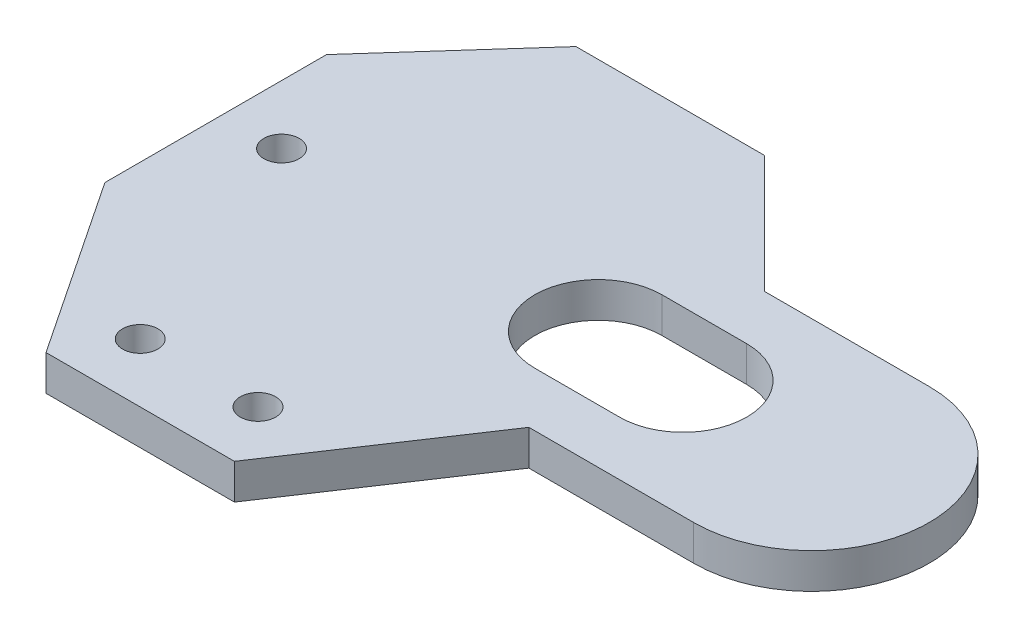
from build123d import *

# Parameters (mm, degrees)
SKETCH1_R           = 1.5
BOSS_EXTRUDE1_DEPTH = 3
FILLET5_RADIUS      = 10
FILLET5_LENGTH      = 3
FILLET2_R           = 5.4
FILLET4_R           = 5.4


with BuildPart() as part:
    # Sketch1 → Boss-Extrude1 (new body)
    # profile 1 of 2: a face of its own
    with BuildSketch(Plane(origin=(0, 0, 0), x_dir=(1, 0, 0), z_dir=(0, 1, 0))):
        with BuildLine():
            Line((3.5, 25), (0, 25))
            Line((0, 25), (0, 15))
            Line((0, 15), (10, 0))
            Line((10, 0), (26, 0))
            Line((26, 0), (36, 15))
            Line((36, 15), (60, 15))
            Line((60, 15), (60, 25))
            Line((60, 25), (44.5, 25))
            Line((44.5, 25), (44.5, 19.6))
            Line((44.5, 19.6), (26.5, 19.6))
            Line((26.5, 19.6), (26.5, 25))
            Line((26.5, 25), (6.5, 25))
            ThreePointArc((6.5, 25), (5, 23.5), (3.5, 25))
        make_face()
        with Locations(Location((13, 5, 0), (0, 0, 270))):
            Circle(SKETCH1_R, mode=Mode.SUBTRACT)
        with Locations(Location((23, 5, 0), (0, 0, 270))):
            Circle(SKETCH1_R, mode=Mode.SUBTRACT)
    # profile 2 of 2: a face of its own
    with BuildSketch(Plane(origin=(0, 0, 0), x_dir=(1, 0, 0), z_dir=(0, 1, 0))):
        with BuildLine():
            Line((10, 45), (0, 33.819660113))
            Line((0, 33.819660113), (0, 25))
            Line((0, 25), (3.5, 25))
            ThreePointArc((3.5, 25), (5, 26.5), (6.5, 25))
            Line((6.5, 25), (26.5, 25))
            Line((26.5, 25), (26.5, 30.4))
            Line((26.5, 30.4), (44.5, 30.4))
            Line((44.5, 30.4), (44.5, 25))
            Line((44.5, 25), (60, 25))
            Line((60, 25), (60, 35))
            Line((60, 35), (36, 35))
            Line((36, 35), (26, 45))
            Line((26, 45), (10, 45))
        make_face()
    extrude(amount=BOSS_EXTRUDE1_DEPTH)

    # Fillet5: full round fillet: the end face becomes a half cylinder, R = half its width
    fillet5_face = Plane((60, 1.5, -25), x_dir=(0, -1, 0), z_dir=(1, 0, 0))  # on the end face: x along it, z out of the body
    fillet5_slab = fillet5_face.offset(-FILLET5_RADIUS / 2) * Box(FILLET5_LENGTH, 2 * FILLET5_RADIUS, FILLET5_RADIUS, mode=Mode.PRIVATE)  # the body's end, R deep
    fillet5_round = Plane((50, 1.5, -25), x_dir=(1, 0, 0), z_dir=(0, -1, 0)) * Cylinder(FILLET5_RADIUS, FILLET5_LENGTH, mode=Mode.PRIVATE)  # its axis R under the face
    add(fillet5_slab - fillet5_round, mode=Mode.SUBTRACT)

    # Fillet2
    fillet2_edges = [part.edges().sort_by_distance(p)[0] for p in [
        (26.5, 1.5, -30.4),
        (26.5, 1.5, -19.6),
    ]]
    fillet(fillet2_edges, radius=FILLET2_R - 0.0001)  # a hair under: the kernel refuses the full size

    # Fillet4
    fillet4_edges = [part.edges().sort_by_distance(p)[0] for p in [
        (44.5, 1.5, -19.6),
        (44.5, 1.5, -30.4),
    ]]
    fillet(fillet4_edges, radius=FILLET4_R - 0.0001)  # a hair under: the kernel refuses the full size


solid = part.part
